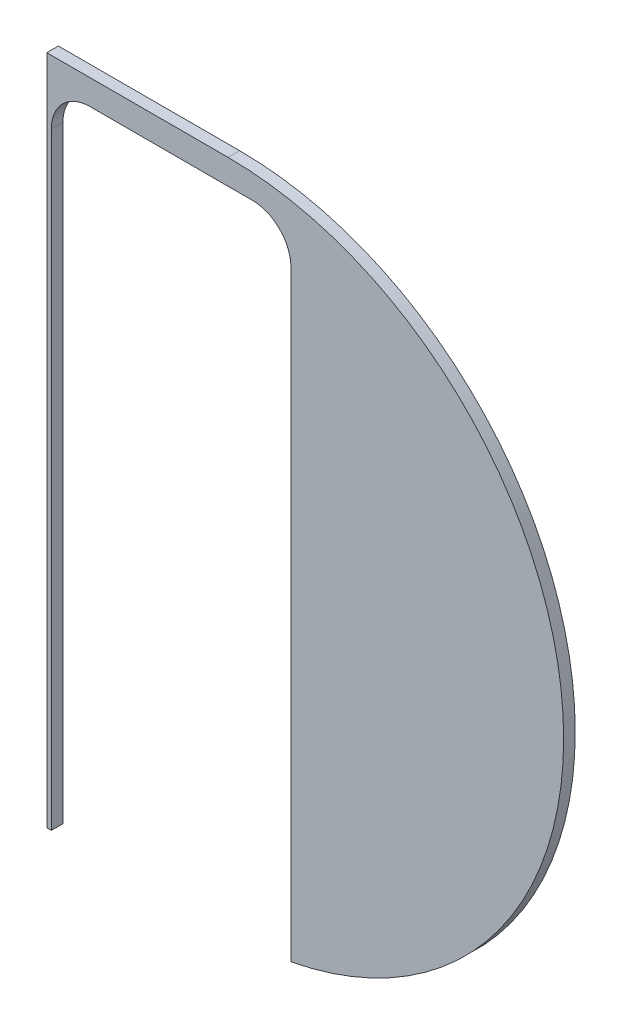
from build123d import *

# Parameters (mm, degrees)
BOSS_EXTRUDE1_DEPTH = 30
CUT_EXTRUDE5_DEPTH  = 330


with BuildPart() as part:
    # Sketch1 → Boss-Extrude1 (new body)
    with BuildSketch(Plane.XY):
        with BuildLine():
            Line((0, 0), (470, 0))
            ThreePointArc((470, 0), (1340, 870), (470, 1740))
            Line((470, 1740), (0, 1740))
            Line((0, 1740), (0, 0))
        make_face()
    extrude(amount=BOSS_EXTRUDE1_DEPTH)

    # Sketch6 → Cut-Extrude5 (cut)
    with BuildSketch(Plane(origin=(-1354.112118138, -994.457487155, -2), x_dir=(-1, 0, 0), z_dir=(0, 0, -1))):
        with BuildLine():
            Line((-1887.112118138, 819.457487155), (-1466.112118138, 819.457487155))
            ThreePointArc((-1466.112118138, 819.457487155), (-1395.40144002, 848.746809036), (-1366.112118138, 919.457487155))
            Line((-1366.112118138, 919.457487155), (-1366.112118138, 2569.457487155))
            ThreePointArc((-1366.112118138, 2569.457487155), (-1395.40144002, 2640.168165273), (-1466.112118138, 2669.457487155))
            Line((-1466.112118138, 2669.457487155), (-1887.112118138, 2669.457487155))
            ThreePointArc((-1887.112118138, 2669.457487155), (-1957.822796257, 2640.168165273), (-1987.112118138, 2569.457487155))
            Line((-1987.112118138, 2569.457487155), (-1987.112118138, 919.457487155))
            ThreePointArc((-1987.112118138, 919.457487155), (-1957.822796257, 848.746809036), (-1887.112118138, 819.457487155))
        make_face()
    extrude(amount=-CUT_EXTRUDE5_DEPTH, mode=Mode.SUBTRACT)


solid = part.part
